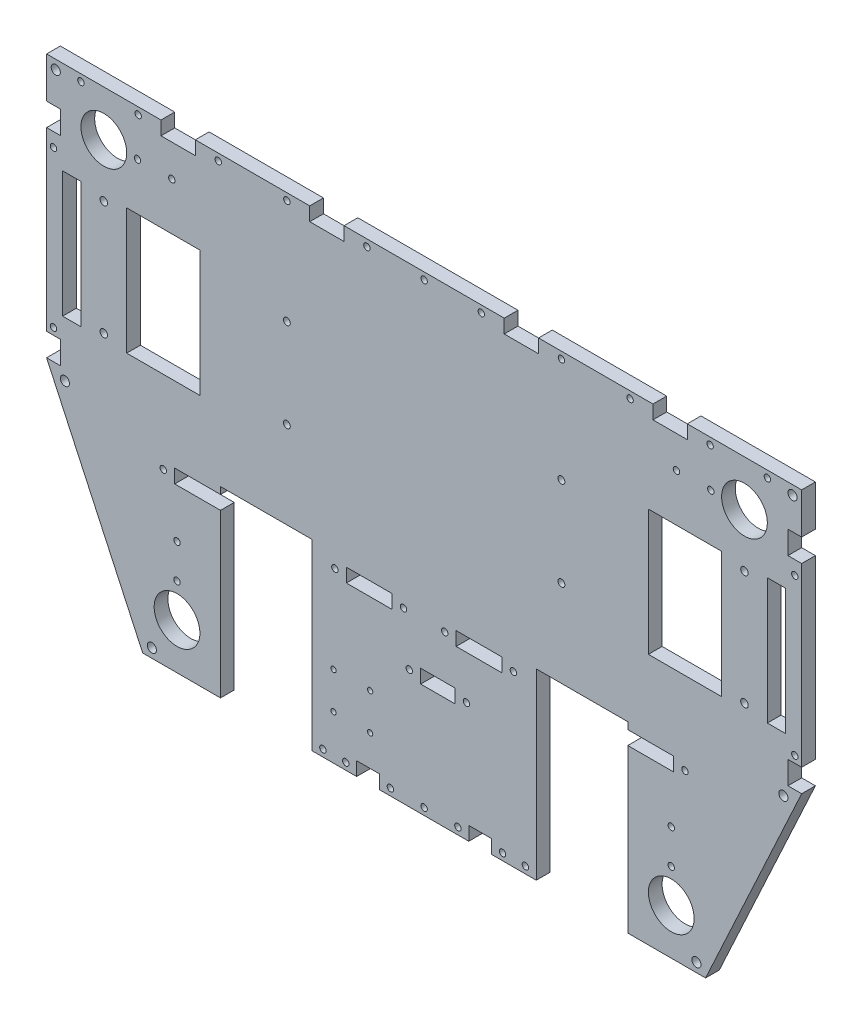
from build123d import *

# Parameters (mm, degrees)
ESQUISSE1_R             = 1.15
ESQUISSE1_W             = 15
ESQUISSE1_H             = 6
BOSS_EXTRU_1_DEPTH      = 6
ESQUISSE2_R             = 10
ESQUISSE2_R_2           = 2
ESQUISSE2_R_3           = 1.4
ESQUISSE2_W             = 8
ESQUISSE2_H             = 55
ESQUISSE2_W_2           = 32
ESQUISSE2_W_3           = 40
ESQUISSE2_H_2           = 80
ENL_V_MAT_EXTRU_1_DEPTH = 6
ESQUISSE3_W             = 6
ESQUISSE3_H             = 10
ESQUISSE3_W_2           = 10
ESQUISSE3_H_2           = 6
ESQUISSE3_W_3           = 15
ENL_V_MAT_EXTRU_2_DEPTH = 6
ESQUISSE4_R             = 1.4
ENL_V_MAT_EXTRU_3_DEPTH = 6
ESQUISSE5_W             = 20
ESQUISSE5_H             = 6
ENL_V_MAT_EXTRU_4_DEPTH = 6
ESQUISSE6_R             = 1.65
ESQUISSE6_R_2           = 1.4
ESQUISSE6_R_3           = 1.5
ENL_V_MAT_EXTRU_5_DEPTH = 6


with BuildPart() as part:
    # Esquisse1 → Boss.-Extru.1 (new body)
    with BuildSketch(Plane.XY):
        Polygon((-165, 96.73), (165, 96.73), (165, -18.27), (123, -109.022410436), (-123, -109.022410436), (-165, -18.27), align=None)
        with Locations((-23.6, -89.522410436)):
            Circle(ESQUISSE1_R, mode=Mode.SUBTRACT)
        with Locations((-23.6, -73.522410436)):
            Circle(ESQUISSE1_R, mode=Mode.SUBTRACT)
        with Locations((-39.6, -89.522410436)):
            Circle(ESQUISSE1_R, mode=Mode.SUBTRACT)
        with Locations((-39.6, -73.522410436)):
            Circle(ESQUISSE1_R, mode=Mode.SUBTRACT)
        with Locations((6, -57.022410436)):
            Rectangle(ESQUISSE1_W, ESQUISSE1_H, mode=Mode.SUBTRACT)
    extrude(amount=BOSS_EXTRU_1_DEPTH)

    # Esquisse2 → Enlèv. mat.-Extru.1 (cut)
    with BuildSketch(Plane.XY.offset(6)):
        with Locations((140, 76.73)):
            Circle(ESQUISSE2_R)
        with Locations((108, -89.022410436)):
            Circle(ESQUISSE2_R)
        with Locations((-140, 76.73)):
            Circle(ESQUISSE2_R)
        with Locations((-108, -89.022410436)):
            Circle(ESQUISSE2_R)
        with Locations((157, -23.022410436)):
            Circle(ESQUISSE2_R_2)
        with Locations((119, -105.022410436)):
            Circle(ESQUISSE2_R_2)
        with Locations((161, 92.73)):
            Circle(ESQUISSE2_R_2)
        with Locations((-161, 92.73)):
            Circle(ESQUISSE2_R_2)
        with Locations((-157, -23.022410436)):
            Circle(ESQUISSE2_R_2)
        with Locations((-119, -105.022410436)):
            Circle(ESQUISSE2_R_2)
        with Locations((125.27, 76.73)):
            Circle(ESQUISSE2_R_3)
        with Locations((110.27, 76.73)):
            Circle(ESQUISSE2_R_3)
        with Locations((108, -74.292410436)):
            Circle(ESQUISSE2_R_3)
        with Locations((108, -59.292410436)):
            Circle(ESQUISSE2_R_3)
        with Locations((-110.27, 76.73)):
            Circle(ESQUISSE2_R_3)
        with Locations((-125.27, 76.73)):
            Circle(ESQUISSE2_R_3)
        with Locations((-108, -59.292410436)):
            Circle(ESQUISSE2_R_3)
        with Locations((-108, -74.292410436)):
            Circle(ESQUISSE2_R_3)
        with Locations((-154, 28.477589564)):
            Rectangle(ESQUISSE2_W, ESQUISSE2_H)
        with Locations((-114, 28.477589564)):
            Rectangle(ESQUISSE2_W_2, ESQUISSE2_H)
        with Locations((114, 28.477589564)):
            Rectangle(ESQUISSE2_W_2, ESQUISSE2_H)
        with Locations((154, 28.477589564)):
            Rectangle(ESQUISSE2_W, ESQUISSE2_H)
        with Locations((69, -69.022410436)):
            Rectangle(ESQUISSE2_W_3, ESQUISSE2_H_2)
        with Locations((-69, -69.022410436)):
            Rectangle(ESQUISSE2_W_3, ESQUISSE2_H_2)
    extrude(amount=-ENL_V_MAT_EXTRU_1_DEPTH, mode=Mode.SUBTRACT)

    # Esquisse3 → Enlèv. mat.-Extru.2 (cut)
    with BuildSketch(Plane(origin=(0, 0, 0), x_dir=(-1, 0, 0), z_dir=(0, 0, -1))):
        with Locations((162, -13.27)):
            Rectangle(ESQUISSE3_W, ESQUISSE3_H)
        with Locations((162, 73.852589564)):
            Rectangle(ESQUISSE3_W, ESQUISSE3_H)
        with Locations((24.5, -106.022410436)):
            Rectangle(ESQUISSE3_W_2, ESQUISSE3_H_2)
        with Locations((-24.5, -106.022410436)):
            Rectangle(ESQUISSE3_W_2, ESQUISSE3_H_2)
        with Locations((-162, 73.852589564)):
            Rectangle(ESQUISSE3_W, ESQUISSE3_H)
        with Locations((-162, -13.27)):
            Rectangle(ESQUISSE3_W, ESQUISSE3_H)
        with Locations((107.5, 93.73)):
            Rectangle(ESQUISSE3_W_3, ESQUISSE3_H_2)
        with Locations((-42.5, 93.73)):
            Rectangle(ESQUISSE3_W_3, ESQUISSE3_H_2)
        with Locations((42.5, 93.73)):
            Rectangle(ESQUISSE3_W_3, ESQUISSE3_H_2)
        with Locations((-107.5, 93.73)):
            Rectangle(ESQUISSE3_W_3, ESQUISSE3_H_2)
    extrude(amount=-ENL_V_MAT_EXTRU_2_DEPTH, mode=Mode.SUBTRACT)

    # Esquisse4 → Enlèv. mat.-Extru.3 (cut)
    with BuildSketch(Plane(origin=(0, 0, 0), x_dir=(-1, 0, 0), z_dir=(0, 0, -1))):
        with Locations((162, -5.27)):
            Circle(ESQUISSE4_R)
        with Locations((0, -106.022410436)):
            Circle(ESQUISSE4_R)
        with Locations((162, 62.852589564)):
            Circle(ESQUISSE4_R)
        with Locations((0, 93.73)):
            Circle(ESQUISSE4_R)
        with Locations((-34.249651607, -106.022410436)):
            Circle(ESQUISSE4_R)
        with Locations((-14.75, -106.022410436)):
            Circle(ESQUISSE4_R)
        with Locations((44.25, -106.022410436)):
            Circle(ESQUISSE4_R)
        with Locations((14.75, -106.022410436)):
            Circle(ESQUISSE4_R)
        with Locations((-44.25, -106.022410436)):
            Circle(ESQUISSE4_R)
        with Locations((34.249651607, -106.022410436)):
            Circle(ESQUISSE4_R)
        with Locations((150, 93.73)):
            Circle(ESQUISSE4_R)
        with Locations((125, 93.73)):
            Circle(ESQUISSE4_R)
        with Locations((90, 93.73)):
            Circle(ESQUISSE4_R)
        with Locations((-25, 93.73)):
            Circle(ESQUISSE4_R)
        with Locations((60, 93.73)):
            Circle(ESQUISSE4_R)
        with Locations((25, 93.73)):
            Circle(ESQUISSE4_R)
        with Locations((-60, 93.73)):
            Circle(ESQUISSE4_R)
        with Locations((-90, 93.73)):
            Circle(ESQUISSE4_R)
        with Locations((-125, 93.73)):
            Circle(ESQUISSE4_R)
        with Locations((-150, 93.73)):
            Circle(ESQUISSE4_R)
        with Locations((-162, 62.852589564)):
            Circle(ESQUISSE4_R)
        with Locations((-162, -5.27)):
            Circle(ESQUISSE4_R)
    extrude(amount=-ENL_V_MAT_EXTRU_3_DEPTH, mode=Mode.SUBTRACT)

    # Esquisse5 → Enlèv. mat.-Extru.4 (cut)
    with BuildSketch(Plane(origin=(0, 0, 0), x_dir=(-1, 0, 0), z_dir=(0, 0, -1))):
        with Locations((99, -35.022410436)):
            Rectangle(ESQUISSE5_W, ESQUISSE5_H)
        with Locations((24, -35.022410436)):
            Rectangle(ESQUISSE5_W, ESQUISSE5_H)
        with Locations((-24, -35.022410436)):
            Rectangle(ESQUISSE5_W, ESQUISSE5_H)
        with Locations((-99, -35.022410436)):
            Rectangle(ESQUISSE5_W, ESQUISSE5_H)
    extrude(amount=-ENL_V_MAT_EXTRU_4_DEPTH, mode=Mode.SUBTRACT)

    # Esquisse6 → Enlèv. mat.-Extru.5 (cut)
    with BuildSketch(Plane(origin=(0, 0, 0), x_dir=(-1, 0, 0), z_dir=(0, 0, -1))):
        with Locations((-140, 3.48)):
            Circle(ESQUISSE6_R)
        with Locations((-140, 53.48)):
            Circle(ESQUISSE6_R)
        with Locations((140, 53.48)):
            Circle(ESQUISSE6_R)
        with Locations((140, 3.48)):
            Circle(ESQUISSE6_R)
        with Locations((-39, -35.022410436)):
            Circle(ESQUISSE6_R_2)
        with Locations((9, -35.022410436)):
            Circle(ESQUISSE6_R_2)
        with Locations((39, -35.022410436)):
            Circle(ESQUISSE6_R_2)
        with Locations((-9, -35.022410436)):
            Circle(ESQUISSE6_R_2)
        with Locations((-18.5, -57.022410436)):
            Circle(ESQUISSE6_R_2)
        with Locations((6.5, -57.022410436)):
            Circle(ESQUISSE6_R_2)
        with Locations((114, -35.022410436)):
            Circle(ESQUISSE6_R_2)
        with Locations((-114, -35.022410436)):
            Circle(ESQUISSE6_R_2)
        with Locations((-60, 47.98)):
            Circle(ESQUISSE6_R_3)
        with Locations((-60, 8.980305375)):
            Circle(ESQUISSE6_R_3)
        with Locations((60, 8.980305375)):
            Circle(ESQUISSE6_R_3)
        with Locations((60, 47.98)):
            Circle(ESQUISSE6_R_3)
    extrude(amount=-ENL_V_MAT_EXTRU_5_DEPTH, mode=Mode.SUBTRACT)


solid = part.part
